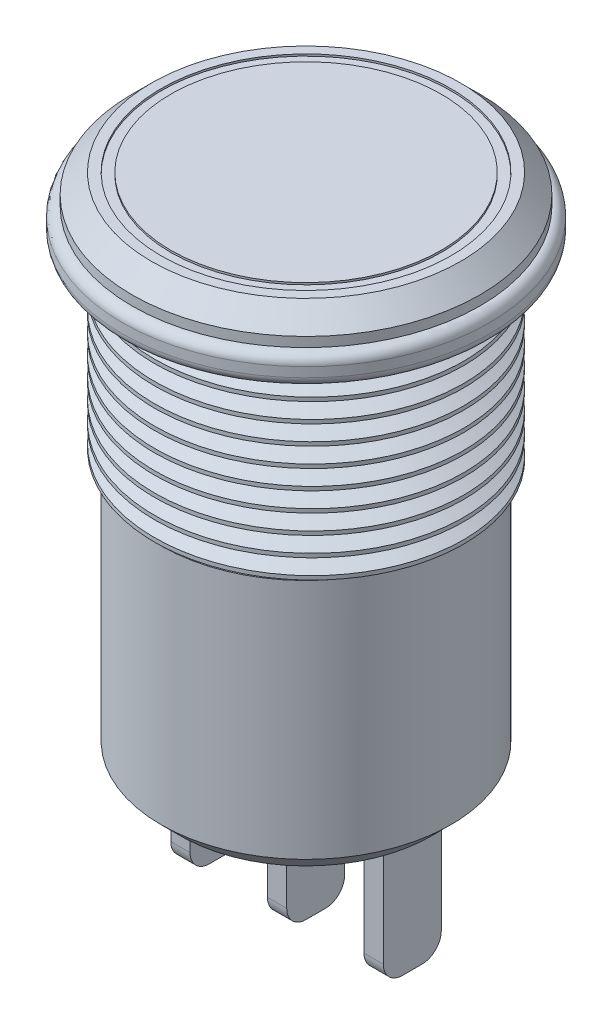
from build123d import *

# Parameters (mm, degrees)
SKETCH_1_R          = 8
EXTRUDE_1_DEPTH     = 10
SKETCH_2_R          = 9.5
EXTRUDE_2_DEPTH     = 1.5
SKETCH_3_R          = 9
EXTRUDE_3_DEPTH     = 1.5
SWEEP_1_PITCH       = 1
SWEEP_1_FROM        = 0
SKETCH_9_R          = 7.5
EXTRUDE_6_DEPTH     = 13.5
SKETCH_12_R         = 7.5
SKETCH_12_R_2       = 7
CUT_EXTRUDE_1_DEPTH = 0.1
SKETCH_13_W         = 1
SKETCH_13_H         = 3
EXTRUDE_9_DEPTH     = 6.5
FILLET_2_R          = 1
CHAMFER_3_SIZE      = 1
FILLET_3_R          = 0.5


with BuildPart() as part:
    # 草图1 → 凸台-拉伸1 (new body)
    with BuildSketch(Plane(origin=(0, 0, 0), x_dir=(1, 0, 0), z_dir=(0, 1, 0))):
        with Locations(Location((0, 0, 0), (0, 0, 270))):
            Circle(SKETCH_1_R)
    extrude(amount=EXTRUDE_1_DEPTH)

    # 草图2 → 凸台-拉伸2 (add)
    with BuildSketch(Plane(origin=(0, 10, 0), x_dir=(1, 0, 0), z_dir=(0, 1, 0))):
        with Locations(Location((0, 0, 0), (0, 0, 270))):
            Circle(SKETCH_2_R)
    extrude(amount=EXTRUDE_2_DEPTH)

    # 草图3 → 凸台-拉伸3 (add)
    with BuildSketch(Plane(origin=(0, 11.5, 0), x_dir=(1, 0, 0), z_dir=(0, 1, 0))):
        with Locations(Location((0, 0, 0), (0, 0, 270))):
            Circle(SKETCH_3_R)
    extrude(amount=EXTRUDE_3_DEPTH)

    # 切除-扫描1: arcs per turn and ends read off the stored shape
    # 切除-扫描1: the profile of 草图8 screwed along a left-hand helix through 11.5 turns, 8 arcs to a turn; built about Z, then put on its axis
    sweep_1_z = Axis((0, 0, 0), (0, 0, 1))
    sweep_1_corners = [(8, 0, -1), (8.5, 0, -1), (8.5, 0, -0.2), (8, 0, -0.2), (7.3, 0, -0.6)]
    with BuildLine(mode=Mode.PRIVATE) as sweep_1_profile:
        Line(sweep_1_corners[0], sweep_1_corners[1])
        Line(sweep_1_corners[1], sweep_1_corners[2])
        Line(sweep_1_corners[2], sweep_1_corners[3])
        Line(sweep_1_corners[3], sweep_1_corners[4])
        Line(sweep_1_corners[4], sweep_1_corners[0])
    sweep_1_cap = Face(sweep_1_profile.wire())
    sweep_1_turn_angles = [0, -22.5, -45, -67.5, -90, -112.5, -135, -157.5, -180, -202.5, -225, -247.5, -270, -292.5, -315, -337.5, -360]
    sweep_1_turn_weights = [1, 0.9238795325112867, 1, 0.9238795325112867, 1, 0.9238795325112867, 1, 0.9238795325112867, 1, 0.9238795325112867, 1, 0.9238795325112867, 1, 0.9238795325112867, 1, 0.9238795325112867, 1]
    sweep_1_turn_rails = [Edge.make_bspline([Vector(p[0], p[1], 0).rotate(sweep_1_z, sweep_1_turn_angles[k]) / sweep_1_turn_weights[k] + Vector(0, 0, p[2] + -SWEEP_1_PITCH * sweep_1_turn_angles[k] / 360) for k in range(17)], [0, 0, 0, 1, 1, 2, 2, 3, 3, 4, 4, 5, 5, 6, 6, 7, 7, 8, 8, 8], 2, sweep_1_turn_weights) for p in sweep_1_corners]
    sweep_1_turn_sides = [Face.make_surface_from_curves(sweep_1_turn_rails[p[0]], sweep_1_turn_rails[p[1]]) for p in [(0, 1), (1, 2), (2, 3), (3, 4), (4, 0)]]
    sweep_1_last_angles = [-3960, -3982.5, -4005, -4027.5, -4050, -4072.5, -4095, -4117.5, -4140]
    sweep_1_last_weights = [1, 0.9238795325112867, 1, 0.9238795325112867, 1, 0.9238795325112867, 1, 0.9238795325112867, 1]
    sweep_1_last_rails = [Edge.make_bspline([Vector(p[0], p[1], 0).rotate(sweep_1_z, sweep_1_last_angles[k]) / sweep_1_last_weights[k] + Vector(0, 0, p[2] + -SWEEP_1_PITCH * sweep_1_last_angles[k] / 360) for k in range(9)], [0, 0, 0, 1, 1, 2, 2, 3, 3, 4, 4, 4], 2, sweep_1_last_weights) for p in sweep_1_corners]
    sweep_1_last_sides = [Face.make_surface_from_curves(sweep_1_last_rails[p[0]], sweep_1_last_rails[p[1]]) for p in [(0, 1), (1, 2), (2, 3), (3, 4), (4, 0)]]
    sweep_1 = Plane(origin=(0, 10, 0), x_dir=(0, 0, -1), z_dir=(0, -1, 0)) * split(Solid(Shell([*[p.moved(Location((0, 0, SWEEP_1_PITCH * i))) for i in range(11) for p in sweep_1_turn_sides], *sweep_1_last_sides, sweep_1_cap, sweep_1_cap.rotate(sweep_1_z, -4140).moved(Location((0, 0, -SWEEP_1_PITCH * -4140 / 360)))])), bisect_by=Plane.XY.offset(SWEEP_1_FROM), keep=Keep.TOP, mode=Mode.PRIVATE)
    add(sweep_1, mode=Mode.SUBTRACT)

    # 草图9 → 凸台-拉伸6 (add)
    with BuildSketch(Plane(origin=(0, 0, 0), x_dir=(-1, 0, 0), z_dir=(0, -1, 0))):
        with Locations(Location((0, 0, 0), (0, 0, 275.329693766))):
            Circle(SKETCH_9_R)
    extrude(amount=EXTRUDE_6_DEPTH)

    # 草图12 → 切除-拉伸1 (cut)
    with BuildSketch(Plane(origin=(0, 13, 0), x_dir=(1, 0, 0), z_dir=(0, 1, 0))):
        with Locations(Location((0, 0, 0), (0, 0, 264.670306234))):
            Circle(SKETCH_12_R)
        with Locations(Location((0, 0, 0), (0, 0, 270))):
            Circle(SKETCH_12_R_2, mode=Mode.SUBTRACT)
    extrude(amount=-CUT_EXTRUDE_1_DEPTH, mode=Mode.SUBTRACT)

    # 草图13 → 凸台-拉伸9 (add)
    with BuildSketch(Plane(origin=(0, -13.5, 0), x_dir=(-1, 0, 0), z_dir=(0, -1, 0))):
        Rectangle(SKETCH_13_W, SKETCH_13_H)
        with Locations((-5, 0)):
            Rectangle(SKETCH_13_W, SKETCH_13_H)
        with Locations((5, 0)):
            Rectangle(SKETCH_13_W, SKETCH_13_H)
    extrude(amount=EXTRUDE_9_DEPTH)

    # 圆角2
    fillet_2_edges = [part.edges().sort_by_distance(p)[0] for p in [
        (5, -20, -1.5),
        (5, -20, 1.5),
        (0, -20, 1.5),
        (0, -20, -1.5),
        (-5, -20, 1.5),
        (-5, -20, -1.5),
    ]]
    fillet(fillet_2_edges, radius=FILLET_2_R)

    # 倒角3
    chamfer_3_edges = [part.edges().sort_by_distance(p)[0] for p in [
        (0, 13, -9),
        (0.6966496, -13.5, -7.467575198),
    ]]
    chamfer(chamfer_3_edges, length=CHAMFER_3_SIZE)

    # 圆角3
    fillet_3_edges = [part.edges().sort_by_distance(p)[0] for p in [
        (0, 10, -9.5),
        (0, 11.5, -9.5),
    ]]
    fillet(fillet_3_edges, radius=FILLET_3_R - 0.0001)  # a hair under: the kernel refuses the full size


solid = part.part
